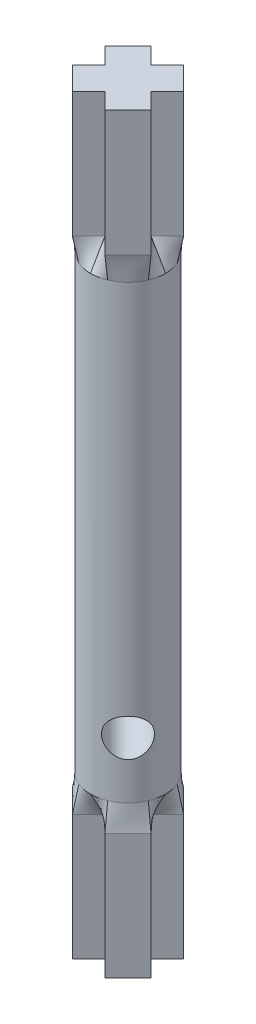
from build123d import *

# Parameters (mm, degrees)
BOSS_EXTRUDE1_DEPTH = 13.804347826
SCALE1_SCALE        = 0.92
SKETCH2_R           = 3.81
SKETCH3_R           = 3.81
BOSS_EXTRUDE2_DEPTH = 22.86
BOSS_EXTRUDE4_DEPTH = 13.804347826
SCALE2_SCALE        = 0.92
SKETCH6_R           = 1.905
CUT_EXTRUDE1_DEPTH  = 78.333121765


with BuildPart() as part:
    # Sketch1 → Boss-Extrude1 (new body)
    with BuildSketch(Plane(origin=(0, 0, 0), x_dir=(1, 0, 0), z_dir=(0, 1, 0))):
        Polygon((-0.6269783, 2.91618698), (-2.423029524, 4.712238204), (-4.963029524, 2.172238204), (-3.1669783, 0.37618698), (-4.963029524, -1.419864244), (-2.423029524, -3.959864244), (-0.6269783, -2.16381302), (1.169072924, -3.959864244), (3.709072924, -1.419864244), (1.9130217, 0.37618698), (3.709072924, 2.172238204), (1.169072924, 4.712238204), align=None)
    extrude(amount=BOSS_EXTRUDE1_DEPTH)


with BuildPart() as part_1:
    # Scale1: scaled about (-0.6269783, 6.902173913, -0.37618698)
    add(part.part.scale(SCALE1_SCALE).moved(Location((-0.050158264, 0.552173913, -0.030094958))))

    # Sketch2 → section 1 of loft1
    with BuildSketch(Plane(origin=(0, 15.792173913, 0), x_dir=(1, 0, 0), z_dir=(0, 1, 0)), mode=Mode.PRIVATE) as loft1_s1:
        with Locations((-0.6269783, 0.37618698)):
            Circle(SKETCH2_R)
    # loft from a face of the part (loft1)
    loft([part_1.faces().sort_by_distance((-0.6269783, 13.252173913, -0.37618698))[0], loft1_s1.sketch])

    # Sketch3 → Boss-Extrude2 (add)
    with BuildSketch(Plane(origin=(0, 15.792173913, 0), x_dir=(1, 0, 0), z_dir=(0, 1, 0))):
        with Locations((-0.6269783, 0.37618698)):
            Circle(SKETCH3_R)
    boss_extrude2 = extrude(amount=BOSS_EXTRUDE2_DEPTH)

    # Mirror6: Boss-Extrude2 across plane
    add(boss_extrude2.mirror(Plane(origin=(-0.6269783, 38.652173913, -0.37618698), x_dir=(0, 0, 1), z_dir=(0, 1, 0))))



with BuildPart() as body_2:
    # Sketch5 → Boss-Extrude4 (new body)
    with BuildSketch(Plane(origin=(0, 63.500993913, 0), x_dir=(1, 0, 0), z_dir=(0, 1, 0))):
        Polygon((-0.6269783, 2.91618698), (-2.423029524, 4.712238204), (-4.963029524, 2.172238204), (-3.1669783, 0.37618698), (-4.963029524, -1.419864244), (-2.423029524, -3.959864244), (-0.6269783, -2.16381302), (1.169072924, -3.959864244), (3.709072924, -1.419864244), (1.9130217, 0.37618698), (3.709072924, 2.172238204), (1.169072924, 4.712238204), align=None)
    extrude(amount=BOSS_EXTRUDE4_DEPTH)


with BuildPart() as body_2_1:
    # Scale2: scaled about (-0.6269783, 70.403167826, -0.37618698)
    add(body_2.part.scale(SCALE2_SCALE).moved(Location((-0.050158264, 5.632253426, -0.030094958))))


with BuildPart() as part_2:
    add(part_1.part)

    add(body_2_1.part)  # loft2 joins it to this body
    # loft from a face of the part (loft2)
    loft([part_2.faces().sort_by_distance((-0.6269783, 61.512173913, -0.37618698))[0], part_2.faces().sort_by_distance((-0.6269783, 64.053167826, -0.37618698))[0]])

    # Sketch6 → Cut-Extrude1 (cut, through all)
    with BuildSketch(Plane(origin=(-3.195659476, 0, -3.195659476), x_dir=(-0.7071067811865471, 0, 0.7071067811865479), z_dir=(-0.7071067811865479, 0, -0.7071067811865471))):
        with Locations((0.177336243, 21.507173913)):
            Circle(SKETCH6_R)
    extrude(amount=-CUT_EXTRUDE1_DEPTH, mode=Mode.SUBTRACT)


solid = part_2.part
